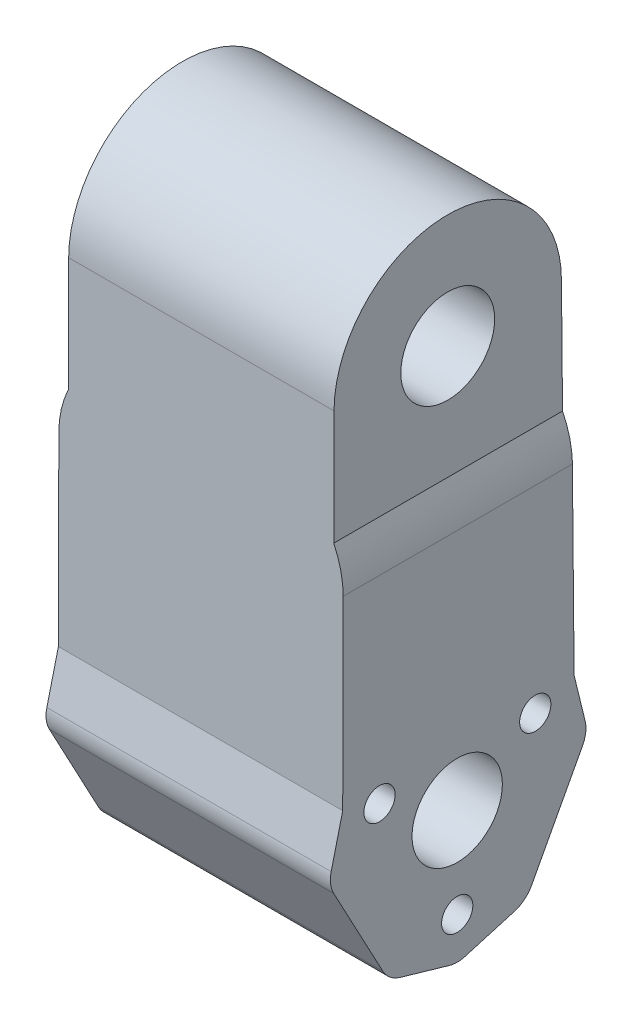
from build123d import *

# Parameters (mm, degrees)
SKETCH3_R                = 4.764999999999999
SKETCH3_R_2              = 1.6499999999999995
SKETCH3_R_3              = 1.6500000000000001
SKETCH3_R_4              = 4.949999999999999
BOSS_EXTRUDE1_DEPTH      = 15
CUT_EXTRUDE2_START       = -13.584871855
CUT_EXTRUDE2_DEPTH       = 26.96953595
CUT_EXTRUDE2_START_2     = -9.35
CUT_EXTRUDE2_2_DEPTH     = 2.4
CUT_EXTRUDE2_START_3     = -12.112585404
CUT_EXTRUDE2_3_OUTLINE_R = 1.65
CUT_EXTRUDE2_3_DEPTH     = 7.445675888


with BuildPart() as part:
    # Sketch3 → Boss-Extrude1 (new, symmetric)
    with BuildSketch(Plane(origin=(0, 0, 0), x_dir=(0, 0, -1), z_dir=(1, 0, 0))):
        with BuildLine():
            Line((0.8367219106320328, 14.181702950289672), (6.032844785264023, 15.69082448784832))
            ThreePointArc((6.032844785264023, 15.69082448784832), (7.085502436432338, 16.24148999245743), (7.8418800486349785, 17.15757597984521))
            Line((7.8418800486349785, 17.15757597984521), (13.230629028910363, 27.2391027259585))
            ThreePointArc((13.230629028910363, 27.2391027259585), (13.56149316864207, 28.279506504021278), (13.498149754436925, 29.369414166277377))
            Line((13.498149754436925, 29.369414166277377), (12.335634292704244, 34.09876588260545))
            Line((12.335634292704244, 34.09876588260545), (12, 69.874079866702))
            ThreePointArc((12, 69.874079866702), (0.03578997764799362, 81.87402649481248), (-11.999786512916659, 69.94565950363487))
            Line((-11.999786512916659, 69.94565950363487), (-12.080609434266979, 33.95094660386098))
            Line((-12.080609434266979, 33.95094660386098), (-13.298066935132345, 28.994347536270237))
            ThreePointArc((-13.298066935132345, 28.994347536270237), (-13.361252777703697, 27.904688590043286), (-13.030421269406453, 26.864544569769336))
            Line((-13.030421269406453, 26.864544569769336), (-7.841880048634967, 17.157575979845202))
            ThreePointArc((-7.841880048634967, 17.157575979845202), (-7.085502436432326, 16.24148999245743), (-6.032844785264015, 15.690824487848316))
            Line((-6.032844785264015, 15.690824487848316), (-0.8367219106320335, 14.18170295028967))
            ThreePointArc((-0.8367219106320335, 14.18170295028967), (1.8e-16, 14.062657036051588), (0.8367219106320328, 14.181702950289672))
        make_face()
        with Locations((1.16e-15, 27.94265703605159)):
            Circle(SKETCH3_R, mode=Mode.SUBTRACT)
        with Locations((0, 18.43265703605159)):
            Circle(SKETCH3_R_2, mode=Mode.SUBTRACT)
        with Locations((8.23590158999005, 32.69765703605151)):
            Circle(SKETCH3_R_3, mode=Mode.SUBTRACT)
        with Locations((-8.19852155344579, 32.659777731318925)):
            Circle(SKETCH3_R_3, mode=Mode.SUBTRACT)
        with Locations((0, 69.874079866702)):
            Circle(SKETCH3_R_4, mode=Mode.SUBTRACT)
    extrude(amount=BOSS_EXTRUDE1_DEPTH, both=True)

    # Cut-Extrude2: read off the stored shape, not the designer's step
    # Cut-Extrude2 outline → Cut-Extrude2 (cut)
    with BuildSketch(Plane.XY.offset(CUT_EXTRUDE2_START)):
        with BuildLine():
            ThreePointArc((-15, 53.515180923), (-14.746794345, 55.751248901), (-14, 57.874079867))
            Line((-14, 57.874079867), (-14, 83))
            Line((-14, 83), (-15, 83))
            Line((-15, 83), (-15, 53.515180923))
        make_face()
        with BuildLine():
            Line((15, 83), (14, 83))
            Line((14, 83), (14, 57.873583349))
            ThreePointArc((14, 57.873583349), (14.746794345, 55.750752383), (15, 53.514684405))
            Line((15, 53.514684405), (15, 83))
        make_face()
    extrude(amount=CUT_EXTRUDE2_DEPTH, mode=Mode.SUBTRACT)

    # Cut-Extrude2 2 outline → Cut-Extrude2 2 (cut)
    with BuildSketch(Plane.XY.offset(CUT_EXTRUDE2_START_2)):
        Polygon((-14, 66.924079867), (1.703183294, 66.924079867), (3.406366588, 69.874079867), (1.703183294, 72.824079867), (-14, 72.824079867), align=None)
    extrude(amount=CUT_EXTRUDE2_2_DEPTH, mode=Mode.SUBTRACT)

    # Cut-Extrude2 3 outline → Cut-Extrude2 3 (cut)
    with BuildSketch(Plane.XY.offset(CUT_EXTRUDE2_START_3)):
        with Locations((0, 69.874079867)):
            Circle(CUT_EXTRUDE2_3_OUTLINE_R)
    extrude(amount=CUT_EXTRUDE2_3_DEPTH, mode=Mode.SUBTRACT)


solid = part.part
